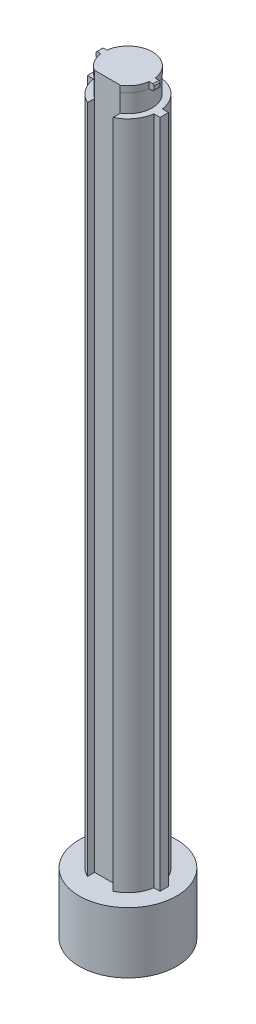
from build123d import *

# Parameters (mm, degrees)
SKETCH1_R           = 25
BOSS_EXTRUDE1_DEPTH = 600
SKETCH1_3_R         = 40
SKETCH1_3_R_2       = 25
BOSS_EXTRUDE2_DEPTH = 50
BOSS_EXTRUDE3_DEPTH = 20
SKETCH30_W          = 5.156865167
SKETCH30_H          = 15
CHAMFER1_SIZE       = 1
SKETCH31_W          = 59.59
SKETCH31_H          = 7
BOSS_EXTRUDE4_DEPTH = 557
SKETCH32_W          = 21
SKETCH32_H          = 8.16254176
CUT_EXTRUDE1_DEPTH  = 570
SHELL2_DEPTH        = 596
SHELL2_2_OUTLINE_R  = 36
SHELL2_2_DEPTH      = 46
SHELL2_START        = 596
SHELL2_3_DEPTH      = 20


# Read off the part's stored shape, not the designer's step: Shell2
with BuildPart() as part:
    # Sketch1 → Boss-Extrude1 (new body)
    with BuildSketch(Plane(origin=(0, 0, 0), x_dir=(1, 0, 0), z_dir=(0, 1, 0))):
        with Locations(Location((0, 0, 0), (0, 0, 270))):
            Circle(SKETCH1_R)
    extrude(amount=BOSS_EXTRUDE1_DEPTH)

    # Sketch1<3> → Boss-Extrude2 (add)
    with BuildSketch(Plane(origin=(0, 0, 0), x_dir=(1, 0, 0), z_dir=(0, 1, 0))):
        with Locations(Location((0, 0, 0), (0, 0, 270))):
            Circle(SKETCH1_3_R)
        with Locations(Location((0, 0, 0), (0, 0, 270))):
            Circle(SKETCH1_3_R_2, mode=Mode.SUBTRACT)
    extrude(amount=BOSS_EXTRUDE2_DEPTH)

    # Sketch2 → Boss-Extrude3 (add)
    with BuildSketch(Plane(origin=(0, 600, 0), x_dir=(1, 0, 0), z_dir=(0, 1, 0))):
        with BuildLine():
            Line((19.843134833, 2.5), (23.869436525, 2.5))
            ThreePointArc((23.869436525, 2.5), (24, 0), (23.869436525, -2.5))
            Line((23.869436525, -2.5), (19.843134833, -2.5))
            ThreePointArc((19.843134833, -2.5), (0, -20), (-19.843134833, -2.5))
            Line((-19.843134833, -2.5), (-23.869436525, -2.5))
            ThreePointArc((-23.869436525, -2.5), (-24, 0), (-23.869436525, 2.5))
            Line((-23.869436525, 2.5), (-19.843134833, 2.5))
            ThreePointArc((-19.843134833, 2.5), (0, 20), (19.843134833, 2.5))
        make_face()
    extrude(amount=BOSS_EXTRUDE3_DEPTH)

    # Sketch30 → Cut-Revolve1 (revolve, cut)
    with BuildSketch(Plane.XY, mode=Mode.PRIVATE) as cut_revolve1_sk:
        with Locations((22.421567417, 607.5)):
            Rectangle(SKETCH30_W, SKETCH30_H)
    revolve(cut_revolve1_sk.sketch.rotate(Axis((0, 498.152783653, 0), (0, 1, 0)), 90), axis=Axis((0, 498.152783653, 0), (0, 1, 0)), mode=Mode.SUBTRACT)

    # Chamfer1
    chamfer1_edges = [part.edges().sort_by_distance(p)[0] for p in [
        (-24, 620, 0),
        (24, 620, 0),
        (-24, 615, 0),
        (24, 615, 0),
    ]]
    chamfer(chamfer1_edges, length=CHAMFER1_SIZE)

    # Sketch31 → Boss-Extrude4 (add)
    with BuildSketch(Plane(origin=(0, 600, 0), x_dir=(1, 0, 0), z_dir=(0, 1, 0))):
        Rectangle(SKETCH31_W, SKETCH31_H)
    extrude(amount=-BOSS_EXTRUDE4_DEPTH)

    # Sketch32 → Cut-Extrude1 (cut)
    with BuildSketch(Plane(origin=(0, 620, 0), x_dir=(1, 0, 0), z_dir=(0, 1, 0))):
        with Locations((0, -20.91872912)):
            Rectangle(SKETCH32_W, SKETCH32_H)
    extrude(amount=-CUT_EXTRUDE1_DEPTH, mode=Mode.SUBTRACT)

    # Shell2 outline → Shell2 (cut)
    with BuildSketch(Plane(origin=(0, 0, 0), x_dir=(1, 0, 0), z_dir=(0, 1, 0))):
        with BuildLine():
            ThreePointArc((14.5, -15.190457531), (0, 21), (-14.5, -15.190457531))
            Line((-14.5, -15.190457531), (-14.5, -12.83745824))
            Line((-14.5, -12.83745824), (14.5, -12.83745824))
            Line((14.5, -12.83745824), (14.5, -15.190457531))
        make_face()
    extrude(amount=SHELL2_DEPTH, mode=Mode.SUBTRACT)

    # Shell2 2 outline → Shell2 2 (cut)
    with BuildSketch(Plane(origin=(0, 0, 0), x_dir=(1, 0, 0), z_dir=(0, 1, 0))):
        Circle(SHELL2_2_OUTLINE_R)
        with BuildLine():
            Line((-14.5, -12.83745824), (-14.5, -15.190457531))
            ThreePointArc((-14.5, -15.190457531), (0, 21), (14.5, -15.190457531))
            Line((14.5, -15.190457531), (14.5, -12.83745824))
            Line((14.5, -12.83745824), (-14.5, -12.83745824))
        make_face(mode=Mode.SUBTRACT)
    extrude(amount=SHELL2_2_DEPTH, mode=Mode.SUBTRACT)

    # Shell2 3 outline → Shell2 3 (cut)
    with BuildSketch(Plane(origin=(0, 0, 0), x_dir=(1, 0, 0), z_dir=(0, 1, 0)).offset(SHELL2_START)):
        with BuildLine():
            ThreePointArc((9.284642549, -12.83745824), (0, 15.843134833), (-9.284642549, -12.83745824))
            Line((-9.284642549, -12.83745824), (9.284642549, -12.83745824))
        make_face()
    extrude(amount=SHELL2_3_DEPTH, mode=Mode.SUBTRACT)


solid = part.part
